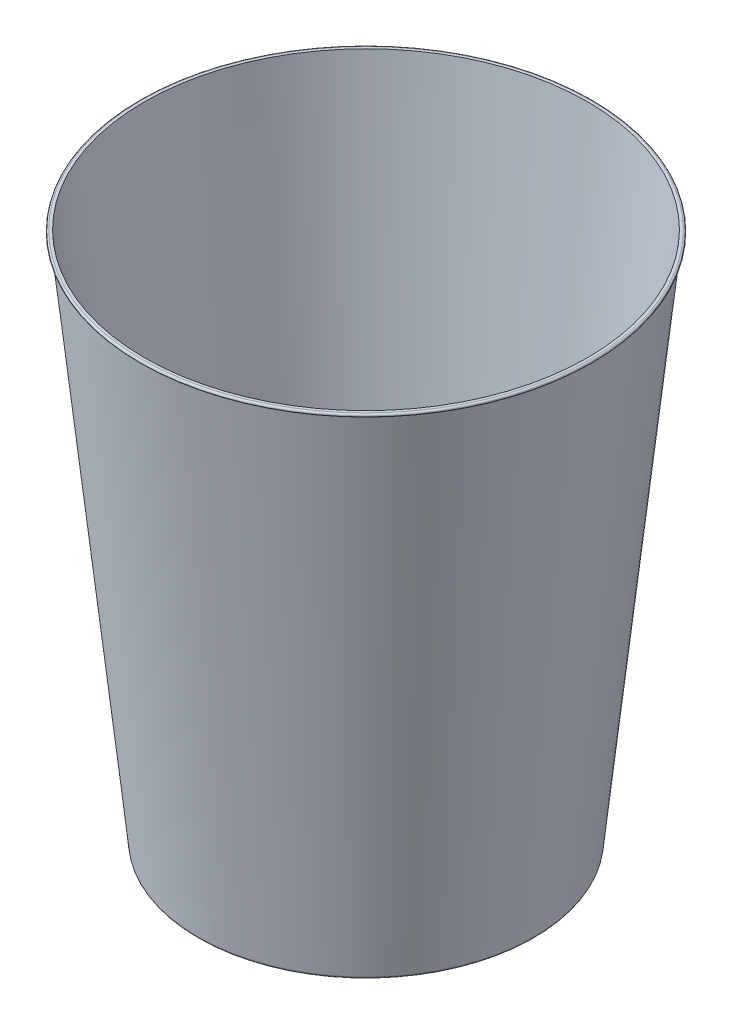
from build123d import *

# Parameters (mm, degrees)
SKETCH1_R           = 35
BOSS_EXTRUDE2_DEPTH = 83
BOSS_EXTRUDE2_DRAFT = -6
SHELL2_T            = -0.3
FILLET3_R           = 0.3


with BuildPart() as part:
    # Sketch1 → Boss-Extrude2 (with draft: the straight prism first)
    with BuildSketch(Plane(origin=(0, 0, 0), x_dir=(1, 0, 0), z_dir=(0, 1, 0))):
        Circle(SKETCH1_R)
    extrude(amount=-BOSS_EXTRUDE2_DEPTH)
    # Boss-Extrude2: the draft: its side faces are tilted about the plane it starts from
    boss_extrude2_sides = [part.faces().sort_by_distance(p)[0] for p in [
        (-35, -41.5, 0),
    ]]
    draft(boss_extrude2_sides, Plane(origin=(0, 0, 0), x_dir=(1, 0, 0), z_dir=(0, 1, 0)), BOSS_EXTRUDE2_DRAFT)

    # Shell2
    shell2_openings = [part.faces().sort_by_distance(p)[0] for p in [
        (0, 0, 0),
    ]]
    offset(amount=SHELL2_T, openings=shell2_openings, kind=Kind.INTERSECTION)

    # Fillet3
    # the kernel refuses this fillet: 0.3 mm, written as the material it takes off along each edge
    with BuildSketch(Plane(origin=(0, 0, 0), x_dir=(1, 0, 0), z_dir=(0, 0, 1))) as fillet3_piece_1:
        with BuildLine():
            CenterArc((34.666988977, -0.298356569), FILLET3_R, 354, 90)
            Line((34.698347516, 0), (34.698974687, 0.005967131))
            ThreePointArc((34.698974687, 0.005967131), (34.849173758, 0.006), (35, 0.006))
            Line((35, 0.006), (35.005967131, -0.000627171))
            Line((35.005967131, -0.000627171), (34.971312677, -0.330342278))
            Line((34.971312677, -0.330342278), (34.965345546, -0.329715108))
        make_face()
    revolve(axis=Axis((0, 0, 0), (0, 1, 0)), mode=Mode.SUBTRACT)
    with BuildSketch(Plane(origin=(0, -83, 0), x_dir=(1, 0, 0), z_dir=(0, 0, 1))) as fillet3_piece_2:
        with BuildLine():
            CenterArc((26.276348473 - FILLET3_R * 0.900404044298, FILLET3_R), FILLET3_R, 270, 84)
            Line((26.276348473 - FILLET3_R * 0.900404044298, 0), (26.276348473 - FILLET3_R * 0.900404044298, -FILLET3_R * 0.02))
            Line((26.276348473 - FILLET3_R * 0.900404044298, -FILLET3_R * 0.02), (26.276348473 + FILLET3_R * 0.018008080886, -FILLET3_R * 0.02))
            Line((26.276348473 + FILLET3_R * 0.018008080886, -FILLET3_R * 0.02), (26.276348473 + FILLET3_R * 0.114008288978, FILLET3_R * 0.893380967467))
            Line((26.276348473 + FILLET3_R * 0.114008288978, FILLET3_R * 0.893380967467), (26.276348473 + FILLET3_R * 0.0941178510704, FILLET3_R * 0.895471536732))
        make_face()
    revolve(axis=Axis((0, -83, 0), (0, 1, 0)), mode=Mode.SUBTRACT)

    # Sketch3 → Revolve1 (revolve)
    with BuildSketch(Plane(origin=(0, 0, 0), x_dir=(0, 0, -1), z_dir=(1, 0, 0)), mode=Mode.PRIVATE) as revolve1_sk:
        with BuildLine():
            Line((34.698347516, 0), (35.118347516, 0))
            ThreePointArc((35.118347516, 0), (35.391403641, -0.267076657), (35.082433767, -0.491636681))
            ThreePointArc((35.082433767, -0.491636681), (35.048670558, -0.463384181), (35.050330688, -0.419390977))
            Line((35.050330688, -0.419390977), (35.075802628, -0.372046083))
            ThreePointArc((35.075802628, -0.372046083), (35.074692042, -0.322709695), (35.031770744, -0.298356569))
            Line((35.031770744, -0.298356569), (34.966988977, -0.298356569))
            Line((34.966988977, -0.298356569), (34.698347516, 0))
        make_face()
    revolve(revolve1_sk.sketch.rotate(Axis((0, 0, 0), (0, 1, 0)), 180), axis=Axis((0, 0, 0), (0, 1, 0)))


solid = part.part
